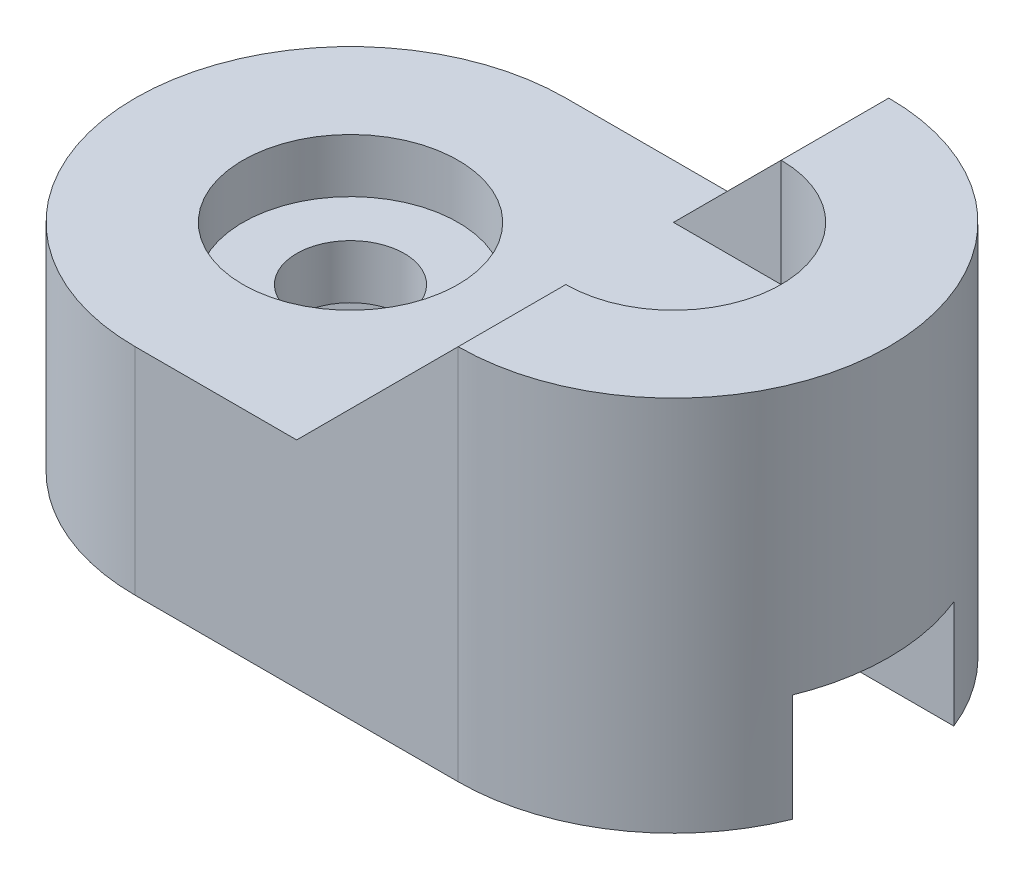
from build123d import *

# Parameters (mm, degrees)
BOSS_EXTRUDE1_DEPTH                     = 40
BOSS_EXTRUDE2_DEPTH                     = 70
RIB7_START                              = -10
RIB7_DEPTH                              = 10
CUT_EXTRUDE1_DEPTH                      = 107.77078252
CUT_EXTRUDE1_DEPTH_BACK                 = 107.77078252
SKETCH3_W                               = 30
SKETCH3_H                               = 20
CBORE_FOR_M5_HEX_HEAD_BOLT1_D           = 20
CBORE_FOR_M5_HEX_HEAD_BOLT1_DEPTH       = 20
CBORE_FOR_M5_HEX_HEAD_BOLT1_CBORE_D     = 40
CBORE_FOR_M5_HEX_HEAD_BOLT1_CBORE_DEPTH = 10
CBORE_FOR_M5_HEX_HEAD_BOLT1_TIP         = 5.773502692


# Read off the part's stored shape, not the designer's step: Rib7
with BuildPart() as part:
    # Sketch1 → Boss-Extrude1 (new body)
    with BuildSketch(Plane(origin=(0, 0, 0), x_dir=(1, 0, 0), z_dir=(0, 1, 0))):
        with BuildLine():
            Line((30, -40), (30, -20))
            ThreePointArc((30, -20), (50, 0), (30, 20))
            Line((30, 20), (30, 40))
            Line((30, 40), (-30, 40))
            ThreePointArc((-30, 40), (-70, 0), (-30, -40))
            Line((-30, -40), (30, -40))
        make_face()
        with BuildLine():
            ThreePointArc((30, -20), (50, 0), (30, 20))
            Line((30, 20), (30, 40))
            ThreePointArc((30, 40), (70, 0), (30, -40))
            Line((30, -40), (30, -20))
        make_face()
    extrude(amount=BOSS_EXTRUDE1_DEPTH)

    # Sketch1<3> → Boss-Extrude2 (add)
    with BuildSketch(Plane(origin=(0, 0, 0), x_dir=(1, 0, 0), z_dir=(0, 1, 0))):
        with BuildLine():
            ThreePointArc((30, -20), (50, 0), (30, 20))
            Line((30, 20), (30, 40))
            ThreePointArc((30, 40), (70, 0), (30, -40))
            Line((30, -40), (30, -20))
        make_face()
    extrude(amount=BOSS_EXTRUDE2_DEPTH)

    # Rib7 outline → Rib7 (add)
    with BuildSketch(Plane(origin=(0, 0, -40), x_dir=(-1, 0, 0), z_dir=(0, 0, -1)).offset(RIB7_START)):
        Polygon((0, 40), (-30, 70), (-30, 40), align=None)
    rib7 = extrude(amount=RIB7_DEPTH)

    # Mirror1: Rib7 across plane
    add(rib7.mirror(Plane.XY))

    # Sketch3 → Cut-Extrude1 (cut, two sides: drawn at the far end of the back side and taken through both)
    with BuildSketch(Plane(origin=(0, 0, 0), x_dir=(0, 0, -1), z_dir=(1, 0, 0)).offset(-CUT_EXTRUDE1_DEPTH_BACK)):
        with Locations((0, 10)):
            Rectangle(SKETCH3_W, SKETCH3_H)
    extrude(amount=CUT_EXTRUDE1_DEPTH + CUT_EXTRUDE1_DEPTH_BACK, mode=Mode.SUBTRACT)

    # CBORE for M5 Hex Head Bolt1
    with Locations(Plane(origin=(0, 40, 0), x_dir=(1, 0, 0), z_dir=(0, 1, 0))):
        with Locations((30, 0), (-30, 0)):
            CounterBoreHole(CBORE_FOR_M5_HEX_HEAD_BOLT1_D / 2, CBORE_FOR_M5_HEX_HEAD_BOLT1_CBORE_D / 2, CBORE_FOR_M5_HEX_HEAD_BOLT1_CBORE_DEPTH, depth=CBORE_FOR_M5_HEX_HEAD_BOLT1_DEPTH)
            with Locations((0, 0, -(CBORE_FOR_M5_HEX_HEAD_BOLT1_DEPTH + CBORE_FOR_M5_HEX_HEAD_BOLT1_TIP / 2))):  # 120° drill point
                Cone(0, CBORE_FOR_M5_HEX_HEAD_BOLT1_D / 2, CBORE_FOR_M5_HEX_HEAD_BOLT1_TIP, mode=Mode.SUBTRACT)


solid = part.part
